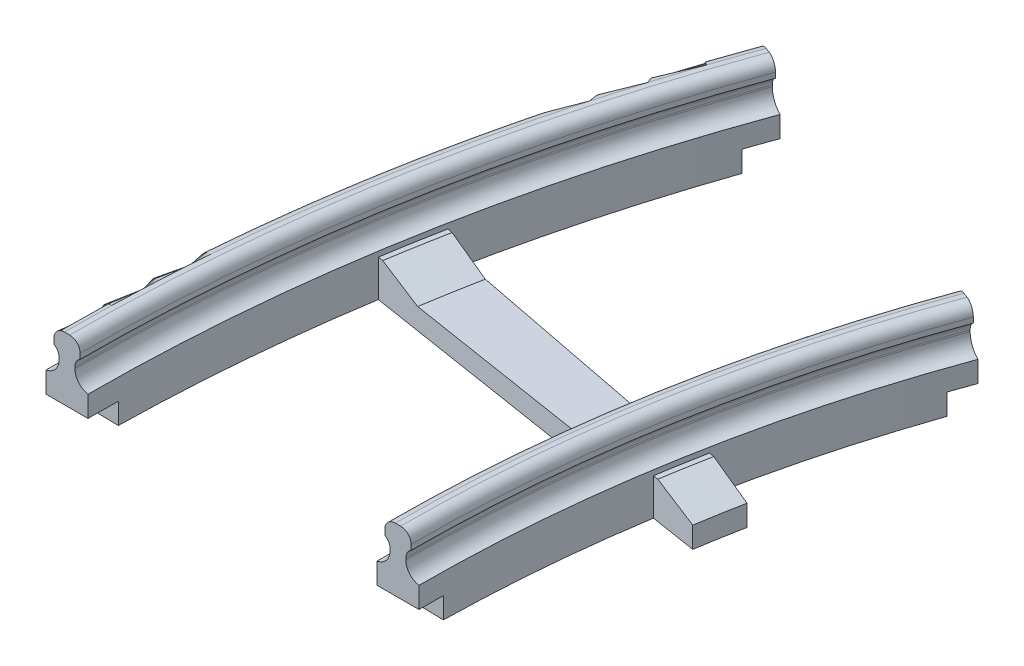
from build123d import *

# Parameters (mm, degrees)
REVOLVE_1_ANGLE     = 10
FILLET_1_R          = 1.5
FILLET_2_R          = 1.5
FILLET_3_R          = 1
FILLET_4_R          = 1
SKETCH_7_W          = 4
SKETCH_7_H          = 2
CUT_REVOLVE_1_ANGLE = 1
SKETCH_10_R         = 0.4
CUT_EXTRUDE_1_DEPTH = 2
REVOLVE_2_ANGLE     = 1


with BuildPart() as part:
    # 草图4 → 旋转1 (revolve)
    with BuildSketch(Plane.XY):
        Polygon((0.75, -1.5), (1.25, -1.5), (1.25, 0), (0, 0), (-1.25, 0), (-1.25, -1.5), (-0.75, -1.5), (-0.75, -4), (-2, -4), (-2, -8), (0, -8), (2, -8), (2, -4), (0.75, -4), align=None)
        Polygon((31.5, 0), (32.75, 0), (32.75, -1.5), (32.25, -1.5), (32.25, -4), (33.5, -4), (33.5, -8), (31.5, -8), (29.5, -8), (29.5, -4), (30.75, -4), (30.75, -1.5), (30.25, -1.5), (30.25, 0), align=None)
    revolve(axis=Axis((165.75, 3.853460973, 0), (0, -1, 0)), revolution_arc=REVOLVE_1_ANGLE)

    # 圆角1
    # the kernel refuses this fillet: 1.5 mm, written as the material it adds along each edge
    with BuildSketch(Plane(origin=(165.75, -4, 0), x_dir=(-1, 0, 0), z_dir=(0, 0, 1))) as fillet_1_piece_1:
        with BuildLine():
            CenterArc((163.5, -1.479019946), FILLET_1_R, 0, 80.405931773)
            Line((165, -1.479019946), (165.03, -1.479019946))
            Line((165.03, -1.479019946), (165.03, 0))
            Line((165.03, 0), (165, 0.03))
            ThreePointArc((165, 0.03), (164.375, 0.03), (163.755, 0.029580399))
            Line((163.755, 0.029580399), (163.75, 0))
        make_face()
    revolve(axis=Axis((165.75, -4, 0), (0, -1, 0)), revolution_arc=10)
    with BuildSketch(Plane(origin=(165.75, -4, 0), x_dir=(-1, 0, 0), z_dir=(0, 0, 1))) as fillet_1_piece_2:
        with BuildLine():
            CenterArc((168, -1.479019946), FILLET_1_R, 99.594068227, 80.405931773)
            Line((166.5, -1.479019946), (166.47, -1.479019946))
            Line((166.47, -1.479019946), (166.47, 0))
            Line((166.47, 0), (166.5, 0.03))
            ThreePointArc((166.5, 0.03), (167.125, 0.03), (167.745, 0.029580399))
            Line((167.745, 0.029580399), (167.75, 0))
        make_face()
    revolve(axis=Axis((165.75, -4, 0), (0, -1, 0)), revolution_arc=10)

    # 圆角2
    # the kernel refuses this fillet: 1.5 mm, written as the material it adds along each edge
    with BuildSketch(Plane(origin=(165.75, -4, 0), x_dir=(-1, 0, 0), z_dir=(0, 0, 1))) as fillet_2_piece_1:
        with BuildLine():
            CenterArc((136.5, -1.479019946), FILLET_2_R, 99.594068227, 80.405931773)
            Line((136.25, 0), (136.245, 0.029580399))
            ThreePointArc((136.245, 0.029580399), (135.625, 0.03), (135, 0.03))
            Line((135, 0.03), (134.97, 0))
            Line((134.97, 0), (134.97, -1.479019946))
            Line((134.97, -1.479019946), (135, -1.479019946))
        make_face()
    revolve(axis=Axis((165.75, -4, 0), (0, -1, 0)), revolution_arc=10)
    with BuildSketch(Plane(origin=(165.75, -4, 0), x_dir=(-1, 0, 0), z_dir=(0, 0, 1))) as fillet_2_piece_2:
        with BuildLine():
            CenterArc((132, -1.479019946), FILLET_2_R, 0, 80.405931773)
            Line((133.5, -1.479019946), (133.53, -1.479019946))
            Line((133.53, -1.479019946), (133.53, 0))
            Line((133.53, 0), (133.5, 0.03))
            ThreePointArc((133.5, 0.03), (132.875, 0.03), (132.255, 0.029580399))
            Line((132.255, 0.029580399), (132.25, 0))
        make_face()
    revolve(axis=Axis((165.75, -4, 0), (0, -1, 0)), revolution_arc=10)

    # 圆角3
    # the kernel refuses this fillet: 1 mm, written as the material it adds along each edge
    with BuildSketch(Plane(origin=(165.75, -1.5, 0), x_dir=(-1, 0, 0), z_dir=(0, 0, 1))) as fillet_3_piece_1:
        with BuildLine():
            CenterArc((136, 0.866025404), FILLET_3_R, 180, 60)
            Line((135, 0.866025404), (135, 0))
            Line((135, 0), (135.5, 0))
        make_face()
    revolve(axis=Axis((165.75, -1.5, 0), (0, -1, 0)), revolution_arc=10)
    with BuildSketch(Plane(origin=(165.75, -1.5, 0), x_dir=(-1, 0, 0), z_dir=(0, 0, 1))) as fillet_3_piece_2:
        with BuildLine():
            CenterArc((132.5, 0.866025404), FILLET_3_R, 300, 60)
            Line((133, 0), (133.5, 0))
            Line((133.5, 0), (133.5, 0.866025404))
        make_face()
    revolve(axis=Axis((165.75, -1.5, 0), (0, -1, 0)), revolution_arc=10)
    # the kernel refuses this fillet: 1 mm, written as the material it takes off along each edge
    with BuildSketch(Plane(origin=(165.75, 0, 0), x_dir=(-0.9998233399867428, 0, 0.018795978765534377), z_dir=(0.018795978765534377, 0, 0.9998233399867428))) as fillet_3_2_piece_1:
        with BuildLine():
            CenterArc((133 + FILLET_3_R, FILLET_3_R), FILLET_3_R, 180, 90)
            Line((133, FILLET_3_R), (133, 0))
            Line((133, 0), (133 + FILLET_3_R, 0))
        make_face()
    revolve(axis=Axis((165.75, 0, 0), (0, -1, 0)), revolution_arc=12.153987353, mode=Mode.SUBTRACT)
    with BuildSketch(Plane(origin=(165.75, 0, 0), x_dir=(-0.9998297984864879, 0, 0.01844922921070363), z_dir=(0.01844922921070363, 0, 0.9998297984864879))) as fillet_3_2_piece_2:
        with BuildLine():
            CenterArc((135.5 - FILLET_3_R, FILLET_3_R), FILLET_3_R, 270, 90)
            Line((135.5 - FILLET_3_R, 0), (135.5, 0))
            Line((135.5, 0), (135.5, FILLET_3_R))
        make_face()
    revolve(axis=Axis((165.75, 0, 0), (0, -1, 0)), revolution_arc=12.114245889, mode=Mode.SUBTRACT)

    # 圆角4
    # the kernel refuses this fillet: 1 mm, written as the material it adds along each edge
    with BuildSketch(Plane(origin=(165.75, -1.5, 0), x_dir=(-1, 0, 0), z_dir=(0, 0, 1))) as fillet_4_piece_1:
        with BuildLine():
            CenterArc((167.5, 0.866025404), FILLET_4_R, 180, 60)
            Line((167, 0), (166.5, 0))
            Line((166.5, 0), (166.5, 0.866025404))
        make_face()
    revolve(axis=Axis((165.75, -1.5, 0), (0, -1, 0)), revolution_arc=10)
    with BuildSketch(Plane(origin=(165.75, -1.5, 0), x_dir=(-1, 0, 0), z_dir=(0, 0, 1))) as fillet_4_piece_2:
        with BuildLine():
            CenterArc((164, 0.866025404), FILLET_4_R, 300, 60)
            Line((164.5, 0), (165, 0))
            Line((165, 0), (165, 0.866025404))
        make_face()
    revolve(axis=Axis((165.75, -1.5, 0), (0, -1, 0)), revolution_arc=10)
    # the kernel refuses this fillet: 1 mm, written as the material it takes off along each edge
    with BuildSketch(Plane(origin=(165.75, 0, 0), x_dir=(-0.9998845180351503, 0, 0.015197058715919934), z_dir=(0.015197058715919934, 0, 0.9998845180351503))) as fillet_4_2_piece_1:
        with BuildLine():
            CenterArc((164.5 + FILLET_4_R, FILLET_4_R), FILLET_4_R, 180, 90)
            Line((164.5, FILLET_4_R), (164.5, 0))
            Line((164.5, 0), (164.5 + FILLET_4_R, 0))
        make_face()
    revolve(axis=Axis((165.75, 0, 0), (0, -1, 0)), revolution_arc=11.74152169, mode=Mode.SUBTRACT)
    with BuildSketch(Plane(origin=(165.75, 0, 0), x_dir=(-0.9998879496351009, 0, 0.014969574961036002), z_dir=(0.014969574961036002, 0, 0.9998879496351009))) as fillet_4_2_piece_2:
        with BuildLine():
            CenterArc((167 - FILLET_4_R, FILLET_4_R), FILLET_4_R, 270, 90)
            Line((167 - FILLET_4_R, 0), (167, 0))
            Line((167, 0), (167, FILLET_4_R))
        make_face()
    revolve(axis=Axis((165.75, 0, 0), (0, -1, 0)), revolution_arc=11.715451006, mode=Mode.SUBTRACT)

    # 草图7 → 切除-旋转1 (revolve, cut)
    with BuildSketch(Plane.XY):
        with Locations((0, -7)):
            Rectangle(SKETCH_7_W, SKETCH_7_H)
        with Locations((31.5, -7)):
            Rectangle(SKETCH_7_W, SKETCH_7_H)
    revolve(axis=Axis((165.75, 3.853460973, 0), (0, -1, 0)), revolution_arc=CUT_REVOLVE_1_ANGLE, mode=Mode.SUBTRACT)

    # 草图10 → 切除-拉伸1 (cut)
    with BuildSketch(Plane.XZ.offset(6)):
        with Locations(Location((0.006311252, -1.446423259, 0), (0, 0, 270))):
            Circle(SKETCH_10_R)
        with Locations(Location((31.505111829, -1.171537391, 0), (0, 0, 270))):
            Circle(SKETCH_10_R)
    extrude(amount=-CUT_EXTRUDE_1_DEPTH, mode=Mode.SUBTRACT)

    # 草图11 → 旋转2 (revolve)
    with BuildSketch(Plane(origin=(4.997974052, 0, -28.344919378), x_dir=(-0.9848077530122081, 0, -0.17364817766693072), z_dir=(0.17364817766693072, 0, -0.9848077530122081))):
        Polygon((-26.981885062, -4.5), (-26.481885062, -4.5), (-22.481885062, -6), (-3.981885062, -6), (0.018114938, -4.5), (0.518114938, -4.5), (4.518114938, -4.5), (5.018114938, -4.5), (9.018114938, -6), (9.018114938, -8), (4.518114938, -8), (0.518114938, -8), (-26.981885062, -8), (-30.981885062, -8), (-35.481885062, -8), (-35.481885062, -6), (-31.481885062, -4.5), (-30.981885062, -4.5), align=None)
    revolve(axis=Axis((165.75, 3.853460973, 0), (0, 1, 0)), revolution_arc=REVOLVE_2_ANGLE)

    # 镜向1: part across face


with BuildPart() as part_1:
    add(part.part)
    add(part.part.mirror(Plane(origin=(18.028837048, -5.996688627, -26.04722665), x_dir=(0.9848077529548817, 0, 0.17364817799204443), z_dir=(0.17364817799204443, 0, -0.9848077529548818))))


solid = part_1.part
